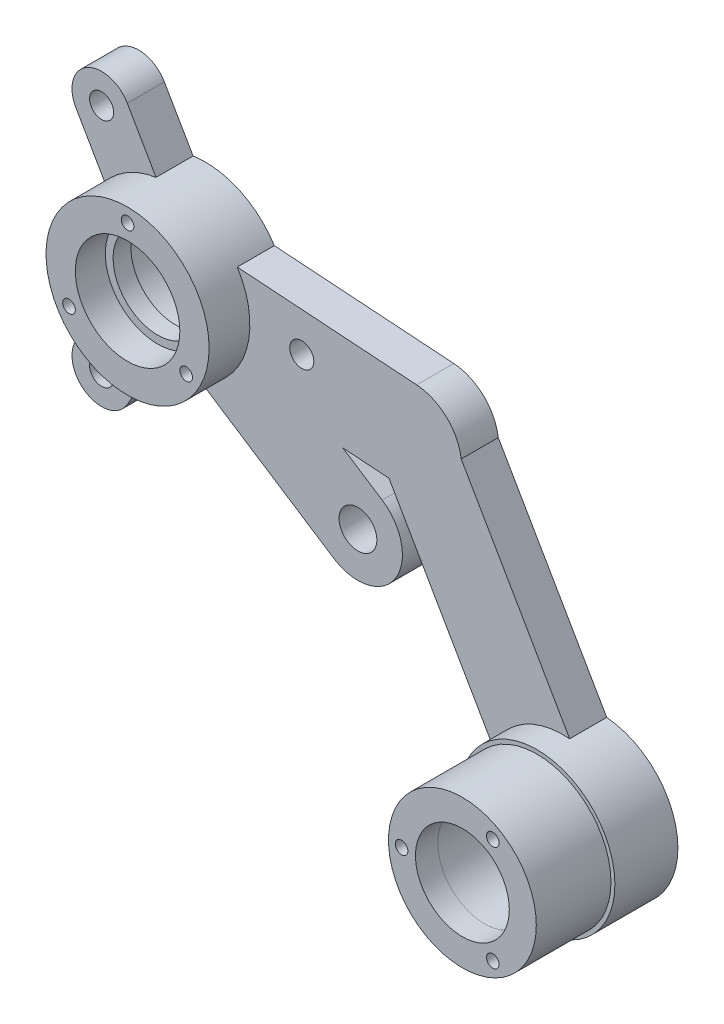
from build123d import *

# Parameters (mm, degrees)
S01_BEARING_BARREL_R                           = 22
F_01_BEARING_BARREL_DEPTH                      = 21
F_02_TORQUE_ARM_1_DEPTH                        = 10
F_03_TORQUE_ARM_2_DEPTH                        = 10
F_04_TORQUE_ARM_3_DEPTH                        = 10
F_05_WHEEL_ARM_ROOT_TO_ROUNDED_ELBOW_DEPTH     = 10
F_06_LONG_DROPPED_WHEEL_ARM_DEPTH              = 10
F_07_BROAD_CAM_FOLLOWER_MOUNTING_LUG_DEPTH     = 10
F_08_START                                     = -1
S08_BEARING_THROUGH_RELIEF_R                   = 12
F_08_BEARING_THROUGH_RELIEF_DEPTH              = 23
F_09_START                                     = -0.1
S09_INBOARD_6001_SEAT_R                        = 14.1
F_09_INBOARD_6001_SEAT_DEPTH                   = 8.2
F_10_START                                     = 12.9
S10_OUTBOARD_6001_SEAT_R                       = 14.1
F_10_OUTBOARD_6001_SEAT_DEPTH                  = 8.2
F_11_START                                     = -1
S11_KEEPER_SCREWS_R                            = 1.7
F_11_KEEPER_SCREWS_DEPTH                       = 23
F_12_START                                     = -1
S12_TORQUE_PIN_RETAINING_STEMS_R               = 3.25
F_12_TORQUE_PIN_RETAINING_STEMS_DEPTH          = 12
S13_WHEEL_TIP_THROUGH_BOLT_LAND_R              = 21
F_13_WHEEL_TIP_THROUGH_BOLT_LAND_DEPTH         = 10
F_14_START                                     = 10
S14_INBOARD_6808_INNER_RACE_SHOULDER_R         = 21
F_14_INBOARD_6808_INNER_RACE_SHOULDER_DEPTH    = 7
F_15_START                                     = 17
S15_HOLLOW_6808_WHEEL_BEARING_JOURNAL_R        = 19.94
F_15_HOLLOW_6808_WHEEL_BEARING_JOURNAL_DEPTH   = 20.15
F_16_START                                     = -0.2
S16_AXIAL_MOTOR_INSTALLATION_PASSAGE_R         = 12.66
F_16_AXIAL_MOTOR_INSTALLATION_PASSAGE_DEPTH    = 37.55
F_17_START                                     = -0.2
S17_GEARBOX_BODY_AND_WIRING_APPROACH_R         = 12.85
F_17_GEARBOX_BODY_AND_WIRING_APPROACH_DEPTH    = 31.35
F_18_START                                     = -0.2
S18_WHEEL_FACEPLATE_THROUGH_BOLT_PATTE_R       = 1.7
F_18_WHEEL_FACEPLATE_THROUGH_BOLT_PATTER_DEPTH = 37.55
F_19_START                                     = -1
S19_THROUGH_BORE_FOR_STEEL_FOLLOWER_BU_R       = 5.1
F_19_THROUGH_BORE_FOR_STEEL_FOLLOWER_BUS_DEPTH = 12
F_20_START                                     = -0.1
S20_FLUSH_SEAT_FOR_BUSH_FLANGE_R               = 7.6
F_20_FLUSH_SEAT_FOR_BUSH_FLANGE_DEPTH          = 2.1


with BuildPart() as part:
    # S01 - Bearing barrel → 01 - Bearing barrel (new body)
    with BuildSketch(Plane.XY):
        Circle(S01_BEARING_BARREL_R)
    extrude(amount=F_01_BEARING_BARREL_DEPTH)

    # S02 - Torque arm 1 → 02 - Torque arm 1 (add)
    with BuildSketch(Plane.XY):
        with BuildLine():
            Line((0, 8), (36, 8))
            ThreePointArc((36, 8), (44, 0), (36, -8))
            Line((36, -8), (0, -8))
            ThreePointArc((0, -8), (-8, 0), (0, 8))
        make_face()
    extrude(amount=F_02_TORQUE_ARM_1_DEPTH)

    # S03 - Torque arm 2 → 03 - Torque arm 2 (add)
    with BuildSketch(Plane.XY):
        with BuildLine():
            Line((-6.92820323, -4), (-24.92820323, 27.176914536))
            ThreePointArc((-24.92820323, 27.176914536), (-22, 38.105117767), (-11.07179677, 35.176914536))
            Line((-11.07179677, 35.176914536), (6.92820323, 4))
            ThreePointArc((6.92820323, 4), (4, -6.92820323), (-6.92820323, -4))
        make_face()
    extrude(amount=F_03_TORQUE_ARM_2_DEPTH)

    # S04 - Torque arm 3 → 04 - Torque arm 3 (add)
    with BuildSketch(Plane.XY):
        with BuildLine():
            Line((6.92820323, -4), (-11.07179677, -35.176914536))
            ThreePointArc((-11.07179677, -35.176914536), (-22, -38.105117767), (-24.92820323, -27.176914536))
            Line((-24.92820323, -27.176914536), (-6.92820323, 4))
            ThreePointArc((-6.92820323, 4), (4, 6.92820323), (6.92820323, -4))
        make_face()
    extrude(amount=F_04_TORQUE_ARM_3_DEPTH)

    # S05 - Wheel arm root to rounded elbow → 05 - Wheel arm root to rounded elbow (add)
    with BuildSketch(Plane.XY):
        with BuildLine():
            Line((0.890943823, 12.969434032), (67.022341031, 8.426494092))
            ThreePointArc((67.022341031, 8.426494092), (79.10083124, -5.433883763), (65.240453385, -17.512373972))
            Line((65.240453385, -17.512373972), (-0.890943823, -12.969434032))
            ThreePointArc((-0.890943823, -12.969434032), (-12.969434032, 0.890943823), (0.890943823, 12.969434032))
        make_face()
    extrude(amount=F_05_WHEEL_ARM_ROOT_TO_ROUNDED_ELBOW_DEPTH)

    # S06 - Long dropped wheel arm → 06 - Long dropped wheel arm (add)
    with BuildSketch(Plane.XY):
        with BuildLine():
            Line((76.528125799, 1.449391376), (116.886494349, -68.572605409))
            ThreePointArc((116.886494349, -68.572605409), (112.482097074, -84.961665317), (96.093037167, -80.557268042))
            Line((96.093037167, -80.557268042), (55.734668617, -10.535271257))
            ThreePointArc((55.734668617, -10.535271257), (60.139065892, 5.853788651), (76.528125799, 1.449391376))
        make_face()
    extrude(amount=F_06_LONG_DROPPED_WHEEL_ARM_DEPTH)

    # S07 - Broad cam follower mounting lug → 07 - Broad cam follower mounting lug (add)
    with BuildSketch(Plane.XY):
        with BuildLine():
            Line((6.53566842, 10.064046815), (57.694573065, -23.158934321))
            ThreePointArc((57.694573065, -23.158934321), (61.22295146, -39.758649556), (44.623236224, -43.287027951))
            Line((44.623236224, -43.287027951), (-6.53566842, -10.064046815))
            ThreePointArc((-6.53566842, -10.064046815), (-10.064046815, 6.53566842), (6.53566842, 10.064046815))
        make_face()
    extrude(amount=F_07_BROAD_CAM_FOLLOWER_MOUNTING_LUG_DEPTH)

    # S08 - Bearing through relief → 08 - Bearing through relief (cut)
    with BuildSketch(Plane.XY.offset(F_08_START)):
        Circle(S08_BEARING_THROUGH_RELIEF_R)
    extrude(amount=F_08_BEARING_THROUGH_RELIEF_DEPTH, mode=Mode.SUBTRACT)

    # S09 - Inboard 6001 seat → 09 - Inboard 6001 seat (cut)
    with BuildSketch(Plane.XY.offset(F_09_START)):
        Circle(S09_INBOARD_6001_SEAT_R)
    extrude(amount=F_09_INBOARD_6001_SEAT_DEPTH, mode=Mode.SUBTRACT)

    # S10 - Outboard 6001 seat → 10 - Outboard 6001 seat (cut)
    with BuildSketch(Plane.XY.offset(F_10_START)):
        Circle(S10_OUTBOARD_6001_SEAT_R)
    extrude(amount=F_10_OUTBOARD_6001_SEAT_DEPTH, mode=Mode.SUBTRACT)

    # S11 - Keeper screws → 11 - Keeper screws (cut)
    with BuildSketch(Plane.XY.offset(F_11_START)):
        with Locations((0, 18.25)):
            Circle(S11_KEEPER_SCREWS_R)
        with Locations((-15.804963619, -9.125)):
            Circle(S11_KEEPER_SCREWS_R)
        with Locations((15.804963619, -9.125)):
            Circle(S11_KEEPER_SCREWS_R)
    extrude(amount=F_11_KEEPER_SCREWS_DEPTH, mode=Mode.SUBTRACT)

    # S12 - Torque pin retaining stems → 12 - Torque pin retaining stems (cut)
    with BuildSketch(Plane.XY.offset(F_12_START)):
        with Locations((36, 0)):
            Circle(S12_TORQUE_PIN_RETAINING_STEMS_R)
        with Locations((-18, 31.176914536)):
            Circle(S12_TORQUE_PIN_RETAINING_STEMS_R)
        with Locations((-18, -31.176914536)):
            Circle(S12_TORQUE_PIN_RETAINING_STEMS_R)
    extrude(amount=F_12_TORQUE_PIN_RETAINING_STEMS_DEPTH, mode=Mode.SUBTRACT)

    # S13 - Wheel tip through-bolt land → 13 - Wheel tip through-bolt land (add)
    with BuildSketch(Plane.XY):
        with Locations((106.489765758, -74.564936726)):
            Circle(S13_WHEEL_TIP_THROUGH_BOLT_LAND_R)
    extrude(amount=F_13_WHEEL_TIP_THROUGH_BOLT_LAND_DEPTH)

    # S14 - Inboard 6808 inner-race shoulder → 14 - Inboard 6808 inner-race shoulder (add)
    with BuildSketch(Plane.XY.offset(F_14_START)):
        with Locations((106.489765758, -74.564936726)):
            Circle(S14_INBOARD_6808_INNER_RACE_SHOULDER_R)
    extrude(amount=F_14_INBOARD_6808_INNER_RACE_SHOULDER_DEPTH)

    # S15 - Hollow 6808 wheel-bearing journal → 15 - Hollow 6808 wheel-bearing journal (add)
    with BuildSketch(Plane.XY.offset(F_15_START)):
        with Locations((106.489765758, -74.564936726)):
            Circle(S15_HOLLOW_6808_WHEEL_BEARING_JOURNAL_R)
    extrude(amount=F_15_HOLLOW_6808_WHEEL_BEARING_JOURNAL_DEPTH)

    # S16 - Axial motor installation passage → 16 - Axial motor installation passage (cut)
    with BuildSketch(Plane.XY.offset(F_16_START)):
        with Locations((106.489765758, -74.564936726)):
            Circle(S16_AXIAL_MOTOR_INSTALLATION_PASSAGE_R)
    extrude(amount=F_16_AXIAL_MOTOR_INSTALLATION_PASSAGE_DEPTH, mode=Mode.SUBTRACT)

    # S17 - Gearbox body and wiring approach → 17 - Gearbox body and wiring approach (cut)
    with BuildSketch(Plane.XY.offset(F_17_START)):
        with Locations((106.489765758, -74.564936726)):
            Circle(S17_GEARBOX_BODY_AND_WIRING_APPROACH_R)
    extrude(amount=F_17_GEARBOX_BODY_AND_WIRING_APPROACH_DEPTH, mode=Mode.SUBTRACT)

    # S18 - Wheel faceplate through-bolt pattern → 18 - Wheel faceplate through-bolt pattern (cut)
    with BuildSketch(Plane.XY.offset(F_18_START)):
        with Locations((114.689765758, -60.362120104)):
            Circle(S18_WHEEL_FACEPLATE_THROUGH_BOLT_PATTE_R)
        with Locations((90.089765758, -74.564936726)):
            Circle(S18_WHEEL_FACEPLATE_THROUGH_BOLT_PATTE_R)
        with Locations((114.689765758, -88.767753348)):
            Circle(S18_WHEEL_FACEPLATE_THROUGH_BOLT_PATTE_R)
    extrude(amount=F_18_WHEEL_FACEPLATE_THROUGH_BOLT_PATTER_DEPTH, mode=Mode.SUBTRACT)

    # S19 - Through bore for steel follower bush → 19 - Through bore for steel follower bush (cut)
    with BuildSketch(Plane.XY.offset(F_19_START)):
        with Locations((51.158904645, -33.222981136)):
            Circle(S19_THROUGH_BORE_FOR_STEEL_FOLLOWER_BU_R)
    extrude(amount=F_19_THROUGH_BORE_FOR_STEEL_FOLLOWER_BUS_DEPTH, mode=Mode.SUBTRACT)

    # S20 - Flush seat for bush flange → 20 - Flush seat for bush flange (cut)
    with BuildSketch(Plane.XY.offset(F_20_START)):
        with Locations((51.158904645, -33.222981136)):
            Circle(S20_FLUSH_SEAT_FOR_BUSH_FLANGE_R)
    extrude(amount=F_20_FLUSH_SEAT_FOR_BUSH_FLANGE_DEPTH, mode=Mode.SUBTRACT)


solid = part.part
